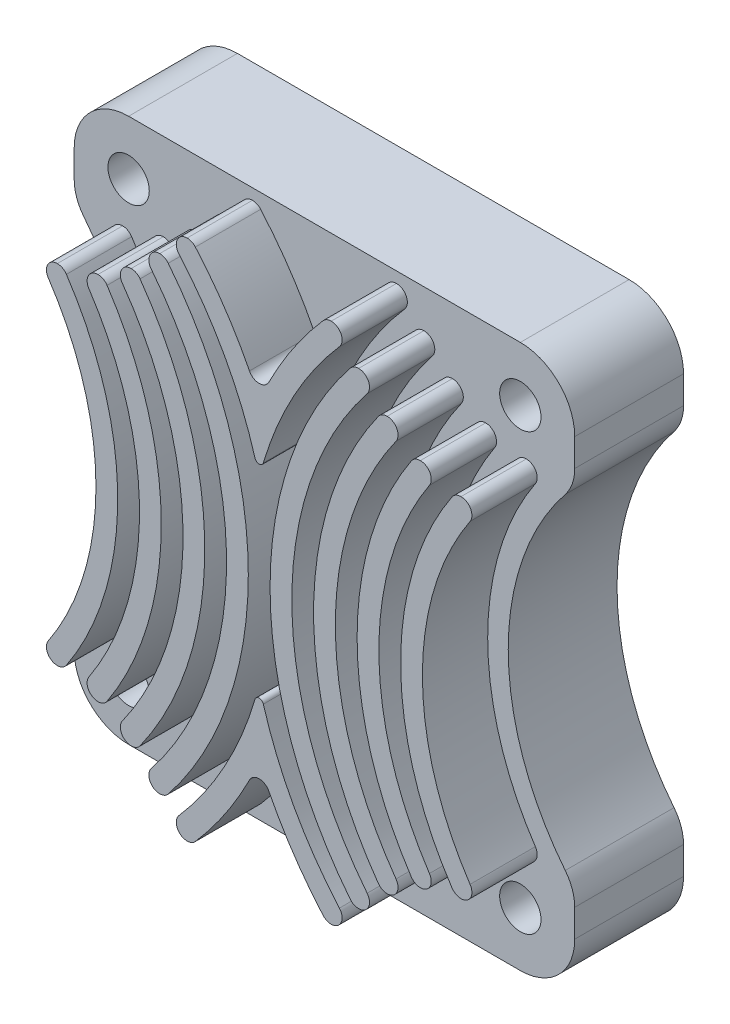
from build123d import *

# Parameters (mm, degrees)
ESQUISSE1_R             = 0.95
BOSS_EXTRU_1_DEPTH      = 5
ESQUISSE2_W             = 14
ESQUISSE2_H             = 13
ENL_V_MAT_EXTRU_1_DEPTH = 3
BOSS_EXTRU_3_DEPTH      = 3
CONG_4_R                = 0.5
CONG_5_R                = 0.2
SYM_TRIE2_START         = 5
SYM_TRIE2_DEPTH         = 3
CONG_6_R                = 2


# Read off the part's stored shape, not the designer's step: Symétrie2
with BuildPart() as part:
    # Esquisse1 → Boss.-Extru.1 (new body)
    with BuildSketch(Plane.XY):
        with BuildLine():
            Line((-11.5, -8), (-11.5, -10))
            ThreePointArc((-11.5, -10), (-10.767766953, -11.767766953), (-9, -12.5))
            Line((-9, -12.5), (9, -12.5))
            ThreePointArc((9, -12.5), (10.767766953, -11.767766953), (11.5, -10))
            Line((11.5, -10), (11.5, -8))
            ThreePointArc((11.5, -8), (8.44427191, 0), (11.5, 8))
            Line((11.5, 8), (11.5, 10))
            ThreePointArc((11.5, 10), (10.767766953, 11.767766953), (9, 12.5))
            Line((9, 12.5), (-9, 12.5))
            ThreePointArc((-9, 12.5), (-10.767766953, 11.767766953), (-11.5, 10))
            Line((-11.5, 10), (-11.5, 8))
            ThreePointArc((-11.5, 8), (-8.44427191, 0), (-11.5, -8))
        make_face()
        with Locations((-9, -10)):
            Circle(ESQUISSE1_R, mode=Mode.SUBTRACT)
        with Locations((9, -10)):
            Circle(ESQUISSE1_R, mode=Mode.SUBTRACT)
        with Locations((-9, 10)):
            Circle(ESQUISSE1_R, mode=Mode.SUBTRACT)
        with Locations((9, 10)):
            Circle(ESQUISSE1_R, mode=Mode.SUBTRACT)
    extrude(amount=BOSS_EXTRU_1_DEPTH)

    # Esquisse2 → Enlèv. mat.-Extru.1 (cut)
    with BuildSketch(Plane(origin=(0, 0, 0), x_dir=(-1, 0, 0), z_dir=(0, 0, -1))):
        Rectangle(ESQUISSE2_W, ESQUISSE2_H)
    extrude(amount=-ENL_V_MAT_EXTRU_1_DEPTH, mode=Mode.SUBTRACT)

    # Esquisse5 → Boss.-Extru.3 (add)
    with BuildSketch(Plane.XY.offset(5)):
        with BuildLine():
            Line((-10.253049234, 8), (-9.010874707, 8))
            ThreePointArc((-9.010874707, 8), (-6.5, 0), (-9.010874707, -8))
            Line((-9.010874707, -8), (-10.253049234, -8))
            ThreePointArc((-10.253049234, -8), (-7.5, 0), (-10.253049234, 8))
        make_face()
        with BuildLine():
            Line((-8.375702269, -8.5), (-7.140792906, -8.5))
            ThreePointArc((-7.140792906, -8.5), (-4.5, 0), (-7.140792906, 8.5))
            Line((-7.140792906, 8.5), (-8.375702269, 8.5))
            ThreePointArc((-8.375702269, 8.5), (-5.5, 0), (-8.375702269, -8.5))
        make_face()
        with BuildLine():
            Line((-6.891813234, 9.5), (-5.62560681, 9.5))
            ThreePointArc((-5.62560681, 9.5), (-2.5, 0), (-5.62560681, -9.5))
            Line((-5.62560681, -9.5), (-6.891813234, -9.5))
            ThreePointArc((-6.891813234, -9.5), (-3.5, 0), (-6.891813234, 9.5))
        make_face()
        with BuildLine():
            Line((-5.649367106, 10.75), (-4.330432809, 10.75))
            ThreePointArc((-4.330432809, 10.75), (-0.5, 0), (-4.330432809, -10.75))
            Line((-4.330432809, -10.75), (-5.649367106, -10.75))
            ThreePointArc((-5.649367106, -10.75), (-1.5, 0), (-5.649367106, 10.75))
        make_face()
        with BuildLine():
            Line((-4.458405421, 12), (-3.083592135, 12))
            ThreePointArc((-3.083592135, 12), (-1.34998742, 9.719934096), (0, 7.193747285))
            ThreePointArc((0, 7.193747285), (1.34998742, 9.719934096), (3.083592135, 12))
            Line((3.083592135, 12), (4.458405421, 12))
            ThreePointArc((4.458405421, 12), (1.691654483, 8.349425312), (0, 4.092676386))
            ThreePointArc((0, 4.092676386), (-1.691654483, 8.349425312), (-4.458405421, 12))
        make_face()
        with BuildLine():
            Line((-4.458405421, -12), (-3.083592135, -12))
            ThreePointArc((-3.083592135, -12), (-1.34998742, -9.719934096), (0, -7.193747285))
            ThreePointArc((0, -7.193747285), (1.34998742, -9.719934096), (3.083592135, -12))
            Line((3.083592135, -12), (4.458405421, -12))
            ThreePointArc((4.458405421, -12), (1.691654483, -8.349425312), (0, -4.092676386))
            ThreePointArc((0, -4.092676386), (-1.691654483, -8.349425312), (-4.458405421, -12))
        make_face()
    extrude(amount=BOSS_EXTRU_3_DEPTH)

    # Congé4
    cong_4_edges = [part.edges().sort_by_distance(p)[0] for p in [
        (4.458405421, 12, 6.5),
        (3.083592135, 12, 6.5),
        (0, 7.193747285, 6.5),
        (-3.083592135, 12, 6.5),
        (-4.458405421, 12, 6.5),
        (-4.330432809, 10.75, 6.5),
        (-5.649367106, 10.75, 6.5),
        (-5.62560681, 9.5, 6.5),
        (-6.891813234, 9.5, 6.5),
        (-7.140792906, 8.5, 6.5),
        (-8.375702269, 8.5, 6.5),
        (-9.010874707, 8, 6.5),
        (-10.253049234, 8, 6.5),
        (0, -7.193747285, 6.5),
        (4.458405421, -12, 6.5),
        (3.083592135, -12, 6.5),
        (-3.083592135, -12, 6.5),
        (-4.458405421, -12, 6.5),
        (-4.330432809, -10.75, 6.5),
        (-5.649367106, -10.75, 6.5),
        (-5.62560681, -9.5, 6.5),
        (-6.891813234, -9.5, 6.5),
        (-7.140792906, -8.5, 6.5),
        (-8.375702269, -8.5, 6.5),
        (-9.010874707, -8, 6.5),
        (-10.253049234, -8, 6.5),
    ]]
    fillet(cong_4_edges, radius=CONG_4_R - 0.0001)  # a hair under: the kernel refuses the full size

    # Congé5
    cong_5_edges = [part.edges().sort_by_distance(p)[0] for p in [
        (0, 4.092676386, 6.5),
        (0, -4.092676386, 6.5),
    ]]
    fillet(cong_5_edges, radius=CONG_5_R)

    # Symétrie2 outline → Symétrie2 (add)
    with BuildSketch(Plane.XY.offset(SYM_TRIE2_START)):
        with BuildLine():
            ThreePointArc((9.27502784, -8), (9.715986392, -7.73570226), (9.690767549, -7.222222222))
            ThreePointArc((9.690767549, -7.222222222), (7.5, 0), (9.690767549, 7.222222222))
            ThreePointArc((9.690767549, 7.222222222), (9.715986392, 7.73570226), (9.27502784, 8))
            ThreePointArc((9.27502784, 8), (9.039325579, 7.940958552), (8.85928813, 7.777777778))
            ThreePointArc((8.85928813, 7.777777778), (6.5, 0), (8.85928813, -7.777777778))
            ThreePointArc((8.85928813, -7.777777778), (9.039325579, -7.940958552), (9.27502784, -8))
        make_face()
        with BuildLine():
            ThreePointArc((7.406613378, -8.5), (7.847028542, -8.236716038), (7.823626709, -7.724137931))
            ThreePointArc((7.823626709, -7.724137931), (5.5, 0), (7.823626709, 7.724137931))
            ThreePointArc((7.823626709, 7.724137931), (7.847028542, 8.236716038), (7.406613378, 8.5))
            ThreePointArc((7.406613378, 8.5), (7.169897339, 8.440415165), (6.989600046, 8.275862069))
            ThreePointArc((6.989600046, 8.275862069), (4.5, 0), (6.989600046, -8.275862069))
            ThreePointArc((6.989600046, -8.275862069), (7.169897339, -8.440415165), (7.406613378, -8.5))
        make_face()
        with BuildLine():
            ThreePointArc((5.880570536, -9.5), (6.32507098, -9.228952735), (6.287648906, -8.709677419))
            ThreePointArc((6.287648906, -8.709677419), (3.5, 0), (6.287648906, 8.709677419))
            ThreePointArc((6.287648906, 8.709677419), (6.32507098, 9.228952735), (5.880570536, 9.5))
            ThreePointArc((5.880570536, 9.5), (5.651617801, 9.444500445), (5.473492166, 9.290322581))
            ThreePointArc((5.473492166, 9.290322581), (2.5, 0), (5.473492166, -9.290322581))
            ThreePointArc((5.473492166, -9.290322581), (5.651617801, -9.444500445), (5.880570536, -9.5))
        make_face()
        with BuildLine():
            ThreePointArc((4.569899459, -10.75), (5.020067778, -10.46759707), (4.961720688, -9.939393939))
            ThreePointArc((4.961720688, -9.939393939), (1.5, 0), (4.961720688, 9.939393939))
            ThreePointArc((4.961720688, 9.939393939), (5.020067778, 10.46759707), (4.569899459, 10.75))
            ThreePointArc((4.569899459, 10.75), (4.352302389, 10.700168319), (4.17807823, 10.560606061))
            ThreePointArc((4.17807823, 10.560606061), (0.5, 0), (4.17807823, -10.560606061))
            ThreePointArc((4.17807823, -10.560606061), (4.352302389, -10.700168319), (4.569899459, -10.75))
        make_face()
    extrude(amount=SYM_TRIE2_DEPTH)

    # Congé6
    cong_6_edges = [part.edges().sort_by_distance(p)[0] for p in [
        (11.5, 8, 2.5),
        (11.5, -8, 2.5),
        (-11.5, -8, 2.5),
        (-11.5, 8, 2.5),
    ]]
    fillet(cong_6_edges, radius=CONG_6_R)


solid = part.part
